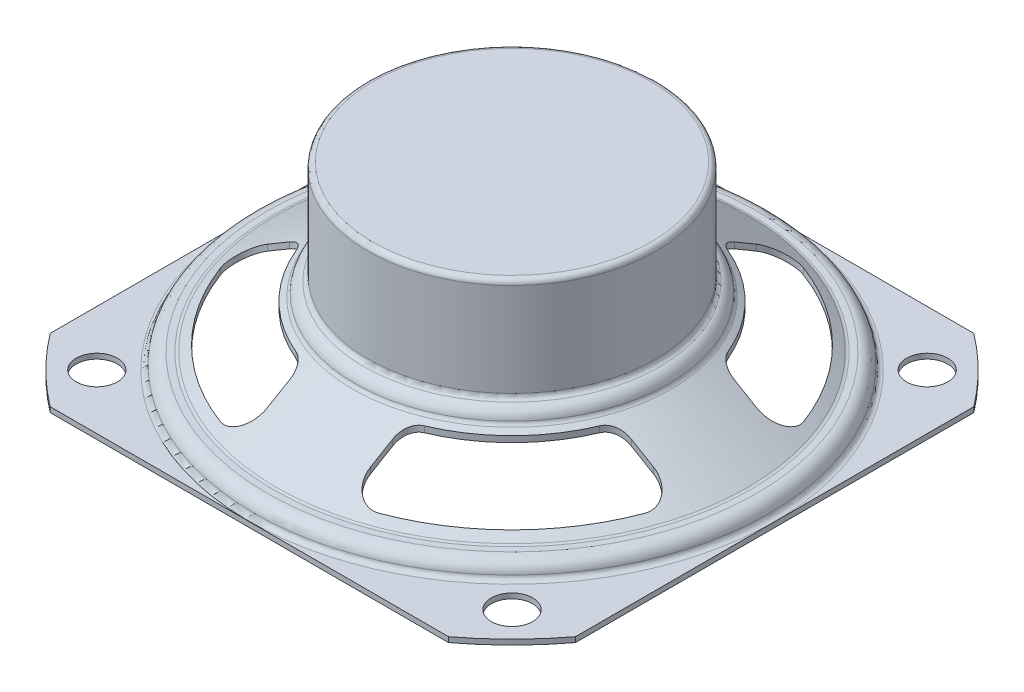
from build123d import *

# Parameters (mm, degrees)
FILLET1_R          = 1.25
CUT_EXTRUDE1_START = -0.5
SKETCH2_R          = 35.082139068
CUT_EXTRUDE1_DEPTH = 8
FILLET2_R          = 0.5
SKETCH3_R          = 2
CUT_EXTRUDE2_DEPTH = 7
CIRPATTERN1_COUNT  = 4


# Read off the part's stored shape, not the designer's step: Shell1
with BuildPart() as part:
    # Sketch1 → Revolve1 (revolve)
    with BuildSketch(Plane.XY):
        Polygon((0, 0), (32, 0), (32, 0.5), (25, 0.5), (25, 2), (23, 2), (15.25, 6.75), (15.25, 8), (14, 8), (14, 18), (0, 18), align=None)
    revolve(axis=Axis((0, -2495.546435065, 0), (0, 1, 0)))

    # Shell1 outline → Shell1 (revolve, cut)
    with BuildSketch(Plane.XY):
        Polygon((24.5, 0), (24.5, 1.5), (22.858965318, 1.5), (14.75, 6.470011001), (14.75, 7.5), (13.5, 7.5), (13.5, 17.5), (0, 17.5), (0, 0), align=None)
    revolve(axis=Axis((0, 0, 0), (0, 1, 0)), mode=Mode.SUBTRACT)

    # Fillet1
    fillet1_edges = [part.edges().sort_by_distance(p)[0] for p in [
        (-15.25, 8, 0),
        (-25, 2, 0),
    ]]
    fillet(fillet1_edges, radius=FILLET1_R - 0.0001)  # a hair under: the kernel refuses the full size

    # Sketch2 → Cut-Extrude1 (cut)
    with BuildSketch(Plane(origin=(0, 0.5, 0), x_dir=(1, 0, 0), z_dir=(0, 1, 0)).offset(CUT_EXTRUDE1_START)):
        Circle(SKETCH2_R)
        Polygon((-25.5, 20), (-20, 25.5), (20, 25.5), (25.5, 20), (25.5, -20), (20, -25.5), (-20, -25.5), (-25.5, -20), align=None, mode=Mode.SUBTRACT)
    extrude(amount=CUT_EXTRUDE1_DEPTH, mode=Mode.SUBTRACT)

    # Fillet2
    fillet2_edges = [part.edges().sort_by_distance(p)[0] for p in [
        (-25, 0.5, 0),
        (-23, 2, 0),
        (-14.75, 6.470011001, 0),
        (-13.5, 7.5, 0),
        (-13.5, 17.5, 0),
        (-14, 18, 0),
        (-15.25, 6.75, 0),
        (-14, 8, 0),
    ]]
    fillet(fillet2_edges, radius=FILLET2_R)

    # Sketch3 → Cut-Extrude2 (cut, symmetric)
    with BuildSketch(Plane(origin=(0, 0.5, 0), x_dir=(1, 0, 0), z_dir=(0, 1, 0))):
        with Locations(Location((20.152543264, -20.152543264, 0), (0, 0, 180))):
            Circle(SKETCH3_R)
        with BuildLine():
            Line((5, -16.583123952), (5, -18.734993995))
            ThreePointArc((5, -18.734993995), (5.859824575, -20.378161668), (7.7, -20.608493395))
            ThreePointArc((7.7, -20.608493395), (15.556349186, -15.556349186), (20.608493395, -7.7))
            ThreePointArc((20.608493395, -7.7), (20.378161668, -5.859824575), (18.734993995, -5))
            Line((18.734993995, -5), (16.583123952, -5))
            ThreePointArc((16.583123952, -5), (15.477582355, -5.333333333), (14.740554624, -6.222222222))
            ThreePointArc((14.740554624, -6.222222222), (11.313708499, -11.313708499), (6.222222222, -14.740554624))
            ThreePointArc((6.222222222, -14.740554624), (5.333333333, -15.477582355), (5, -16.583123952))
        make_face()
    cut_extrude2 = extrude(amount=CUT_EXTRUDE2_DEPTH, both=True, mode=Mode.SUBTRACT)

    # CirPattern1: Cut-Extrude2 ×4 about axis
    cirpattern1_axis = Axis((0, 0, 0), (0, 1, 0))
    for i in range(1, CIRPATTERN1_COUNT):
        add(cut_extrude2.rotate(cirpattern1_axis, i * 360 / CIRPATTERN1_COUNT), mode=Mode.SUBTRACT)


solid = part.part
